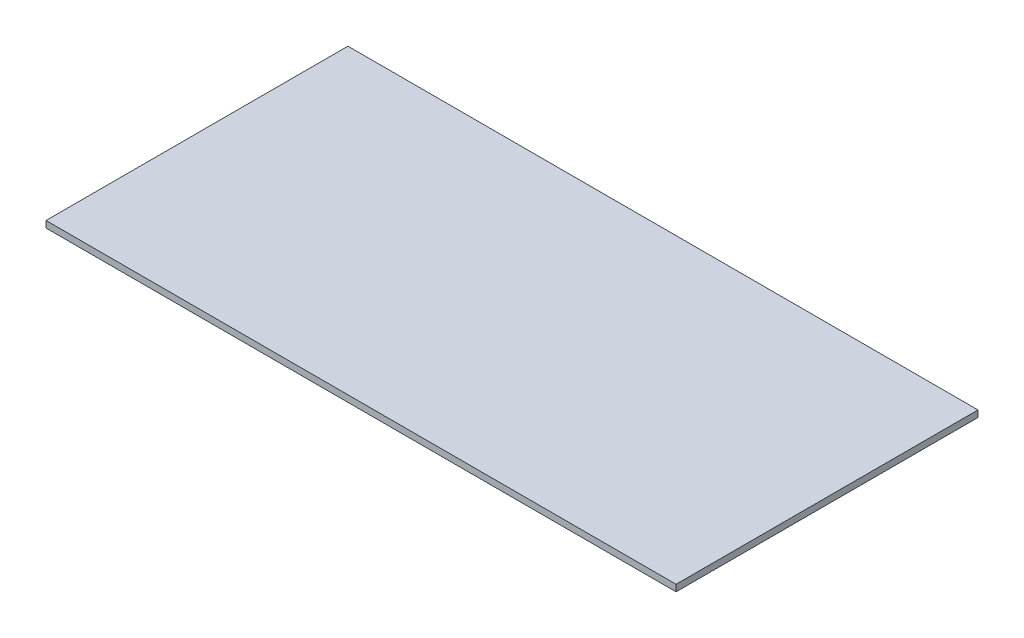
from build123d import *

# Parameters (mm, degrees)
SKETCH1_W           = 609.6
SKETCH1_H           = 292.1
BOSS_EXTRUDE1_DEPTH = 3.175


with BuildPart() as part:
    # Sketch1 → Boss-Extrude1 (new, symmetric)
    with BuildSketch(Plane(origin=(0, 0, 0), x_dir=(1, 0, 0), z_dir=(0, 1, 0))):
        Rectangle(SKETCH1_W, SKETCH1_H)
    extrude(amount=BOSS_EXTRUDE1_DEPTH, both=True)


solid = part.part
